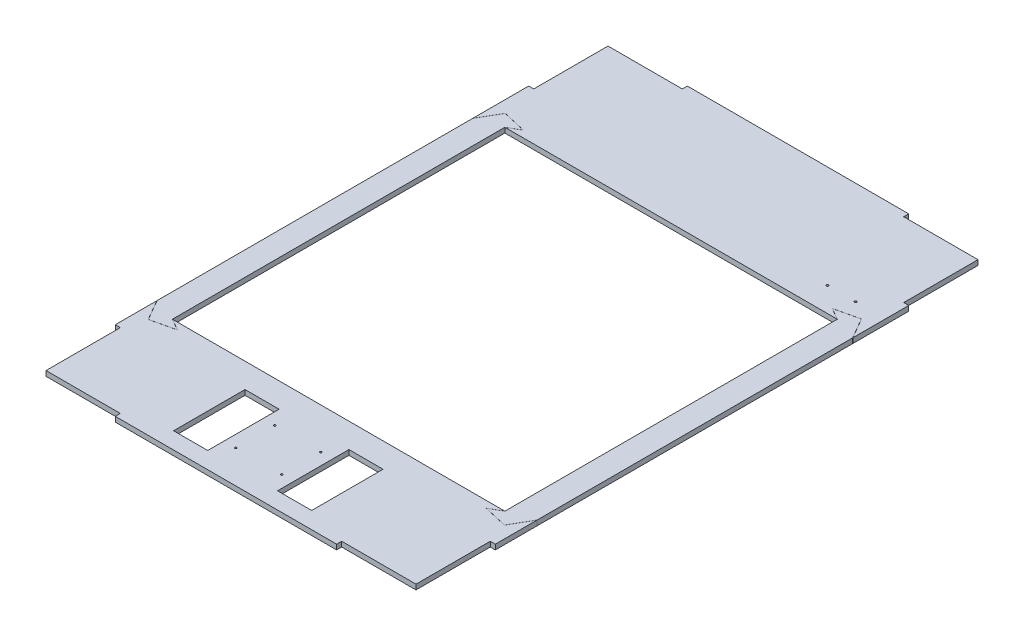
from build123d import *

# Parameters (mm, degrees)
SKETCH1_W           = 479
SKETCH1_H           = 721
SKETCH1_R           = 1.25
SKETCH1_W_2         = 419
SKETCH1_H_2         = 419
SKETCH1_W_3         = 43
SKETCH1_H_3         = 90
BOSS_EXTRUDE1_DEPTH = 3.175
CUT_EXTRUDE1_DEPTH  = 441.375774197
SKETCH3_R           = 1.375
CUT_EXTRUDE2_DEPTH  = 441.375774197
CUT_EXTRUDE3_DEPTH  = 441.375774197


with BuildPart() as part:
    # Sketch1 → Boss-Extrude1 (new, symmetric)
    with BuildSketch(Plane(origin=(0, 0, 0), x_dir=(1, 0, 0), z_dir=(0, 1, 0))):
        with Locations((0, 9)):
            Rectangle(SKETCH1_W, SKETCH1_H)
        with Locations((-29, -310)):
            Circle(SKETCH1_R, mode=Mode.SUBTRACT)
        with Locations((-29, -261)):
            Circle(SKETCH1_R, mode=Mode.SUBTRACT)
        with Locations((29, -261)):
            Circle(SKETCH1_R, mode=Mode.SUBTRACT)
        with Locations((29, -310)):
            Circle(SKETCH1_R, mode=Mode.SUBTRACT)
        Rectangle(SKETCH1_W_2, SKETCH1_H_2, mode=Mode.SUBTRACT)
        with Locations((-65.5, -285.5)):
            Rectangle(SKETCH1_W_3, SKETCH1_H_3, mode=Mode.SUBTRACT)
        with Locations((65.5, -285.5)):
            Rectangle(SKETCH1_W_3, SKETCH1_H_3, mode=Mode.SUBTRACT)
    extrude(amount=BOSS_EXTRUDE1_DEPTH, both=True)

    # Sketch2 → Cut-Extrude1 (cut, through all)
    with BuildSketch(Plane(origin=(0, 3.175, 0), x_dir=(1, 0, 0), z_dir=(0, 1, 0))):
        Polygon((-239.5, 369.5), (-239.5, 269.5), (-233.15, 269.5), (-233.15, 363.15), (-139.5, 363.15), (-139.5, 369.5), align=None)
        Polygon((239.5, 369.5), (139.5, 369.5), (139.5, 363.15), (233.15, 363.15), (233.15, 269.5), (239.5, 269.5), align=None)
        Polygon((239.5, -351.5), (239.5, -251.5), (233.15, -251.5), (233.15, -345.15), (139.5, -345.15), (139.5, -351.5), align=None)
        Polygon((-239.5, -351.5), (-139.5, -351.5), (-139.5, -345.15), (-233.15, -345.15), (-233.15, -251.5), (-239.5, -251.5), align=None)
    extrude(amount=-CUT_EXTRUDE1_DEPTH, mode=Mode.SUBTRACT)

    # Sketch3 → Cut-Extrude2 (cut, through all)
    with BuildSketch(Plane(origin=(0, 3.175, 0), x_dir=(1, 0, 0), z_dir=(0, 1, 0))):
        with Locations((166.32, 240.12)):
            Circle(SKETCH3_R)
        with Locations((201.88, 240.12)):
            Circle(SKETCH3_R)
    extrude(amount=-CUT_EXTRUDE2_DEPTH, mode=Mode.SUBTRACT)

    # Sketch4 → Cut-Extrude3 (cut, through all)
    with BuildSketch(Plane(origin=(0, 3.175, 0), x_dir=(1, 0, 0), z_dir=(0, 1, 0))):
        Polygon((-209.5, -209.5), (-194.769556179, -218.004625705), (-224.450431233, -224.885855623), (-239.5, -198.819237886), (-239.5, -199.019237886), (-224.5, -225), (-194.5, -218.044783984), (-209.3, -209.5), align=None)
        Polygon((-209.3, 209.5), (-209.5, 209.5), (-194.769556179, 218.004625705), (-224.450431233, 224.885855623), (-239.5, 198.819237886), (-239.5, 199.019237886), (-224.5, 225), (-194.5, 218.044783984), align=None)
        Polygon((194.5, -218.044783984), (209.3, -209.5), (209.5, -209.5), (194.769556179, -218.004625705), (224.450431233, -224.885855623), (239.5, -198.819237886), (239.5, -199.019237886), (224.5, -225), align=None)
        Polygon((194.5, 218.044783984), (209.3, 209.5), (209.5, 209.5), (194.769556179, 218.004625705), (224.450431233, 224.885855623), (239.5, 198.819237886), (239.5, 199.019237886), (224.5, 225), align=None)
    extrude(amount=-CUT_EXTRUDE3_DEPTH, mode=Mode.SUBTRACT)


with BuildPart() as cut_extrude3_piece_1:
    # of the separate pieces the step leaves, piece 1, a body of its own (cut_extrude3_pieces)
    add(part.part.solids().sort_by_distance((-239.5, 3.175, -269.5))[0])


with BuildPart() as cut_extrude3_piece_2:
    # of the separate pieces the step leaves, piece 2, a body of its own (cut_extrude3_pieces)
    add(part.part.solids().sort_by_distance((-139.5, 3.175, 351.5))[0])


with BuildPart() as cut_extrude3_piece_3:
    # of the separate pieces the step leaves, piece 3, a body of its own (cut_extrude3_pieces)
    add(part.part.solids().sort_by_distance((224.450431233, 3.175, 224.885855623))[0])


with BuildPart() as cut_extrude3_piece_4:
    # of the separate pieces the step leaves, piece 4, a body of its own (cut_extrude3_pieces)
    add(part.part.solids().sort_by_distance((-239.5, 3.175, -198.819237886))[0])


solid = Compound([cut_extrude3_piece_1.part, cut_extrude3_piece_2.part, cut_extrude3_piece_3.part, cut_extrude3_piece_4.part])
